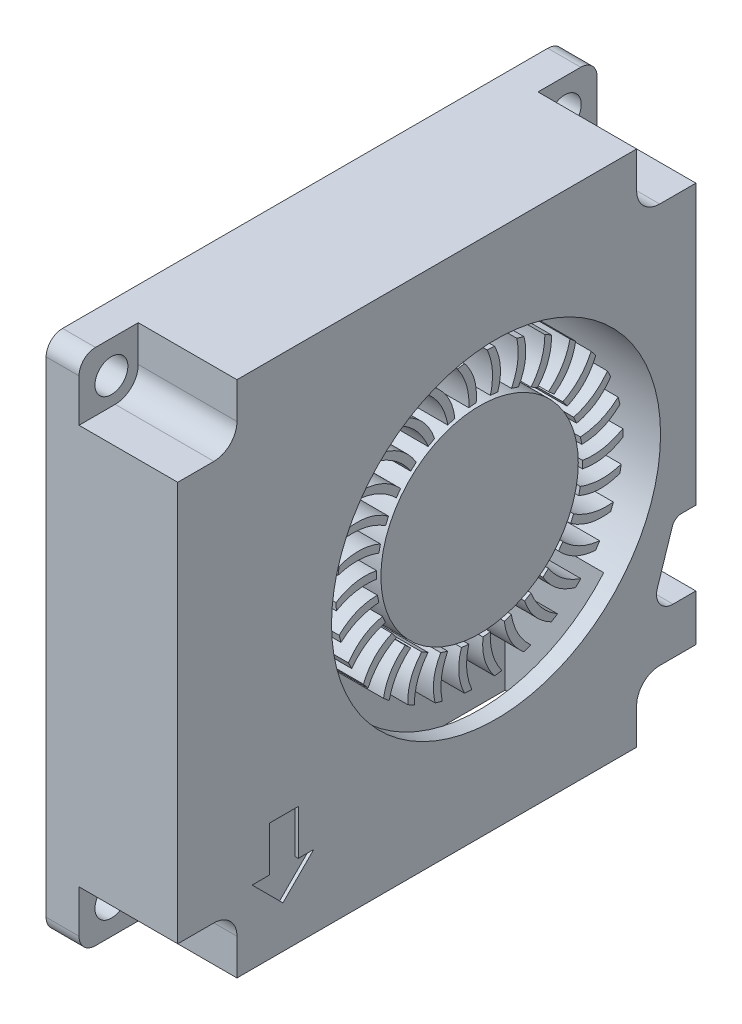
from build123d import *

# Parameters (mm, degrees)
BOSS_EXTRUDE1_DEPTH     = 10.16
CUT_EXTRUDE1_DEPTH      = 7.62
SKETCH3_R               = 12.7
CUT_EXTRUDE2_DEPTH      = 8.89
SKETCH4_W               = 7.62
SKETCH4_H               = 28.31600001
CUT_EXTRUDE3_DEPTH      = 36.576
SKETCH5_R               = 11.43
BOSS_EXTRUDE2_DEPTH     = 1.27
SKETCH6_R               = 7.62
BOSS_EXTRUDE3_DEPTH     = 6.35
CUT_EXTRUDE4_DEPTH      = 0.254
CUT_EXTRUDE5_DEPTH      = 7.62
CUT_EXTRUDE6_DEPTH      = 31.053711924
CUT_EXTRUDE6_DEPTH_BACK = 31.053711924
SKETCH9_R               = 1.27


with BuildPart() as part:
    # Sketch1 → Boss-Extrude1 (new body)
    with BuildSketch(Plane.YZ):
        with BuildLine():
            Line((-18.730000005, -20.000000005), (18.730000005, -20.000000005))
            ThreePointArc((18.730000005, -20.000000005), (19.628025617, -19.628025617), (20.000000005, -18.730000005))
            Line((20.000000005, -18.730000005), (20.000000005, 18.730000005))
            ThreePointArc((20.000000005, 18.730000005), (19.628025617, 19.628025617), (18.730000005, 20.000000005))
            Line((18.730000005, 20.000000005), (-18.730000005, 20.000000005))
            ThreePointArc((-18.730000005, 20.000000005), (-19.628025617, 19.628025617), (-20.000000005, 18.730000005))
            Line((-20.000000005, 18.730000005), (-20.000000005, -18.730000005))
            ThreePointArc((-20.000000005, -18.730000005), (-19.628025617, -19.628025617), (-18.730000005, -20.000000005))
        make_face()
    extrude(amount=BOSS_EXTRUDE1_DEPTH)

    # Sketch2 → Cut-Extrude1 (cut)
    with BuildSketch(Plane.YZ.offset(10.16)):
        with BuildLine():
            Line((-24.572000005, 24.572000005), (-15.428000005, 24.572000005))
            Line((-15.428000005, 24.572000005), (-15.428000005, 17.206000005))
            ThreePointArc((-15.428000005, 17.206000005), (-15.948764148, 15.948764148), (-17.206000005, 15.428000005))
            Line((-17.206000005, 15.428000005), (-24.572000005, 15.428000005))
            Line((-24.572000005, 15.428000005), (-24.572000005, 24.572000005))
        make_face()
        with BuildLine():
            Line((24.572000005, 24.572000005), (15.428000005, 24.572000005))
            Line((15.428000005, 24.572000005), (15.428000005, 17.206000005))
            ThreePointArc((15.428000005, 17.206000005), (15.948764148, 15.948764148), (17.206000005, 15.428000005))
            Line((17.206000005, 15.428000005), (24.572000005, 15.428000005))
            Line((24.572000005, 15.428000005), (24.572000005, 24.572000005))
        make_face()
        with BuildLine():
            Line((24.572000005, -24.572000005), (24.572000005, -15.428000005))
            Line((24.572000005, -15.428000005), (17.206000005, -15.428000005))
            ThreePointArc((17.206000005, -15.428000005), (15.948764148, -15.948764148), (15.428000005, -17.206000005))
            Line((15.428000005, -17.206000005), (15.428000005, -24.572000005))
            Line((15.428000005, -24.572000005), (24.572000005, -24.572000005))
        make_face()
        with BuildLine():
            Line((-24.572000005, -24.572000005), (-15.428000005, -24.572000005))
            Line((-15.428000005, -24.572000005), (-15.428000005, -17.206000005))
            ThreePointArc((-15.428000005, -17.206000005), (-15.948764148, -15.948764148), (-17.206000005, -15.428000005))
            Line((-17.206000005, -15.428000005), (-24.572000005, -15.428000005))
            Line((-24.572000005, -15.428000005), (-24.572000005, -24.572000005))
        make_face()
    extrude(amount=-CUT_EXTRUDE1_DEPTH, mode=Mode.SUBTRACT)

    # Sketch3 → Cut-Extrude2 (cut)
    with BuildSketch(Plane.YZ.offset(10.16)):
        with Locations((0, -4.572)):
            Circle(SKETCH3_R)
    extrude(amount=-CUT_EXTRUDE2_DEPTH, mode=Mode.SUBTRACT)

    # Sketch4 → Cut-Extrude3 (cut)
    with BuildSketch(Plane.XZ.offset(20.000000005)):
        with Locations((5.08, 0)):
            Rectangle(SKETCH4_W, SKETCH4_H)
    extrude(amount=-CUT_EXTRUDE3_DEPTH, mode=Mode.SUBTRACT)

    # Sketch5 → Boss-Extrude2 (add)
    with BuildSketch(Plane.YZ.offset(1.27)):
        with Locations((0, -4.572)):
            Circle(SKETCH5_R)
    extrude(amount=BOSS_EXTRUDE2_DEPTH)

    # Sketch6 → Boss-Extrude3 (add)
    with BuildSketch(Plane.YZ.offset(2.54)):
        with Locations((0, -4.572)):
            Circle(SKETCH6_R)
        with BuildLine():
            Line((-0.563275913, 6.4854637), (0, 6.506990602))
            add(Edge.make_bspline(
                [(0.573958991, 3.375042592), (0.919154895, 5.057851625), (0, 6.506990602)],
                knots=[0, 0, 0, 1, 1, 1], degree=2))
            Line((0.573958991, 3.375042592), (0, 3.375042592))
            add(Edge.make_bspline(
                [(0, 3.375042592), (0.261683692, 5.025053284), (-0.563275913, 6.4854637)],
                knots=[0, 0, 0, 1, 1, 1], degree=2))
        make_face()
        with BuildLine():
            Line((1.652283062, 3.201380644), (2.213699672, 3.08204786))
            add(Edge.make_bspline(
                [(2.213699672, 3.08204786), (2.901227889, 4.656313214), (2.303451669, 6.264888076)],
                knots=[0, 0, 0, 1, 1, 1], degree=2))
            Line((2.303451669, 6.264888076), (1.748008991, 6.360943236))
            add(Edge.make_bspline(
                [(1.652283062, 3.201380644), (2.25130485, 4.760927545), (1.748008991, 6.360943236)],
                knots=[0, 0, 0, 1, 1, 1], degree=2))
        make_face()
        with BuildLine():
            Line((3.232353426, 2.687984662), (3.756691055, 2.454534508))
            add(Edge.make_bspline(
                [(3.756691055, 2.454534508), (4.756503303, 3.851453233), (4.506231446, 5.54916154)],
                knots=[0, 0, 0, 1, 1, 1], degree=2))
            Line((4.506231446, 5.54916154), (3.982897514, 5.758600691))
            add(Edge.make_bspline(
                [(3.232353426, 2.687984662), (4.142533184, 4.088908088), (3.982897514, 5.758600691)],
                knots=[0, 0, 0, 1, 1, 1], degree=2))
        make_face()
        with BuildLine():
            Line((4.671154435, 1.857292512), (5.135497013, 1.519927882))
            add(Edge.make_bspline(
                [(5.135497013, 1.519927882), (6.403896698, 2.678447926), (6.512067286, 4.391091678)],
                knots=[0, 0, 0, 1, 1, 1], degree=2))
            Line((6.512067286, 4.391091678), (6.043714304, 4.704761323))
            add(Edge.make_bspline(
                [(4.671154435, 1.857292512), (5.85271294, 3.038365388), (6.043714304, 4.704761323)],
                knots=[0, 0, 0, 1, 1, 1], degree=2))
        make_face()
        with BuildLine():
            Line((5.90580358, 0.745609428), (6.289857108, 0.319074774))
            add(Edge.make_bspline(
                [(6.289857108, 0.319074774), (7.771409078, 1.188563253), (8.233294537, 2.841291699)],
                knots=[0, 0, 0, 1, 1, 1], degree=2))
            Line((8.233294537, 2.841291699), (7.840391778, 3.245482971))
            add(Edge.make_bspline(
                [(5.90580358, 0.745609428), (7.307101055, 1.655213202), (7.840391778, 3.245482971)],
                knots=[0, 0, 0, 1, 1, 1], degree=2))
        make_face()
        with BuildLine():
            Line((6.88234077, -0.598478704), (7.169320265, -1.095541771))
            add(Edge.make_bspline(
                [(7.169320265, -1.095541771), (8.79927359, -0.553085677), (9.59468731, 0.967495301)],
                knots=[0, 0, 0, 1, 1, 1], degree=2))
            Line((9.59468731, 0.967495301), (9.294406509, 1.444543101))
            add(Edge.make_bspline(
                [(6.88234077, -0.598478704), (8.442133792, -9.8083e-05), (9.294406509, 1.444543101)],
                knots=[0, 0, 0, 1, 1, 1], degree=2))
        make_face()
        with BuildLine():
            Line((7.558086642, -2.116228784), (7.735449725, -2.662096222))
            add(Edge.make_bspline(
                [(7.735449725, -2.662096222), (9.442567622, -2.470380447), (10.536746206, -1.148403623)],
                knots=[0, 0, 0, 1, 1, 1], degree=2))
            Line((10.536746206, -1.148403623), (10.342211076, -0.619348574))
            add(Edge.make_bspline(
                [(7.558086642, -2.116228784), (9.208204771, -1.85522342), (10.342211076, -0.619348574)],
                knots=[0, 0, 0, 1, 1, 1], degree=2))
        make_face()
        with BuildLine():
            Line((7.903507861, -3.74130785), (7.963502912, -4.312122634))
            add(Edge.make_bspline(
                [(7.963502912, -4.312122634), (9.673176139, -4.479526077), (11.018298732, -3.413930138)],
                knots=[0, 0, 0, 1, 1, 1], degree=2))
            Line((11.018298732, -3.413930138), (10.938011392, -2.855990083))
            add(Edge.make_bspline(
                [(7.903507861, -3.74130785), (9.571833016, -3.829084929), (10.938011392, -2.855990083)],
                knots=[0, 0, 0, 1, 1, 1], degree=2))
        make_face()
        with BuildLine():
            Line((7.903507861, -5.40269215), (7.84351281, -5.973506933))
            add(Edge.make_bspline(
                [(7.84351281, -5.973506933), (9.481020442, -6.49271326), (11.018298732, -5.730069862)],
                knots=[0, 0, 0, 1, 1, 1], degree=2))
            Line((11.018298732, -5.730069862), (11.055768123, -5.167629459))
            add(Edge.make_bspline(
                [(7.903507861, -5.40269215), (9.517126228, -5.835415393), (11.055768123, -5.167629459)],
                knots=[0, 0, 0, 1, 1, 1], degree=2))
        make_face()
        with BuildLine():
            Line((7.558086642, -7.027771216), (7.38072356, -7.573638654))
            add(Edge.make_bspline(
                [(7.38072356, -7.573638654), (8.874498656, -8.421956058), (10.536746206, -7.995596377)],
                knots=[0, 0, 0, 1, 1, 1], degree=2))
            Line((10.536746206, -7.995596377), (10.690334736, -7.45323697))
            add(Edge.make_bspline(
                [(7.558086642, -7.027771216), (9.046475355, -7.786528541), (10.690334736, -7.45323697)],
                knots=[0, 0, 0, 1, 1, 1], degree=2))
        make_face()
        with BuildLine():
            Line((6.88234077, -8.545521296), (6.595361274, -9.042584363))
            add(Edge.make_bspline(
                [(6.595361274, -9.042584363), (7.880118695, -10.182937302), (9.59468731, -10.111495301)],
                knots=[0, 0, 0, 1, 1, 1], degree=2))
            Line((9.59468731, -10.111495301), (9.857682423, -9.6129206))
            add(Edge.make_bspline(
                [(6.88234077, -8.545521296), (8.1804501, -9.597151367), (9.857682423, -9.6129206)],
                knots=[0, 0, 0, 1, 1, 1], degree=2))
        make_face()
        with BuildLine():
            Line((5.90580358, -9.889609428), (5.521750052, -10.316144082))
            add(Edge.make_bspline(
                [(5.521750052, -10.316144082), (6.541339733, -11.698693661), (8.233294537, -11.985291699)],
                knots=[0, 0, 0, 1, 1, 1], degree=2))
            Line((8.233294537, -11.985291699), (8.594202085, -11.55229181))
            add(Edge.make_bspline(
                [(5.90580358, -9.889609428), (6.956899921, -11.188150965), (8.594202085, -11.55229181)],
                knots=[0, 0, 0, 1, 1, 1], degree=2))
        make_face()
        with BuildLine():
            Line((4.671154435, -11.001292512), (4.206811857, -11.338657142))
            add(Edge.make_bspline(
                [(4.206811857, -11.338657142), (4.916672836, -12.90297931), (6.512067286, -13.535091678)],
                knots=[0, 0, 0, 1, 1, 1], degree=2))
            Line((6.512067286, -13.535091678), (6.955113877, -13.186590773))
            add(Edge.make_bspline(
                [(4.671154435, -11.001292512), (5.429299832, -12.489993018), (6.955113877, -13.186590773)],
                knots=[0, 0, 0, 1, 1, 1], degree=2))
        make_face()
        with BuildLine():
            Line((3.232353426, -11.831984662), (2.708015797, -12.065434815))
            add(Edge.make_bspline(
                [(2.708015797, -12.065434815), (3.077123744, -13.743161187), (4.506231446, -14.69316154)],
                knots=[0, 0, 0, 1, 1, 1], degree=2))
            Line((4.506231446, -14.69316154), (5.012053819, -14.444390782))
            add(Edge.make_bspline(
                [(3.232353426, -11.831984662), (3.664413288, -13.445780781), (5.012053819, -14.444390782)],
                knots=[0, 0, 0, 1, 1, 1], degree=2))
        make_face()
        with BuildLine():
            Line((1.652283062, -12.345380644), (1.090866452, -12.464713428))
            add(Edge.make_bspline(
                [(1.090866452, -12.464713428), (1.103089578, -14.182519311), (2.303451669, -15.408888076)],
                knots=[0, 0, 0, 1, 1, 1], degree=2))
            Line((2.303451669, -15.408888076), (2.849942957, -15.270719941))
            add(Edge.make_bspline(
                [(1.652283062, -12.345380644), (1.7393743, -14.013741743), (2.849942957, -15.270719941)],
                knots=[0, 0, 0, 1, 1, 1], degree=2))
        make_face()
        with BuildLine():
            Line((0, -12.519042592), (-0.573958991, -12.519042592))
            add(Edge.make_bspline(
                [(-0.573958991, -12.519042592), (-0.919154895, -14.201851625), (0, -15.650990602)],
                knots=[0, 0, 0, 1, 1, 1], degree=2))
            Line((0, -15.650990602), (0.563275913, -15.6294637))
            add(Edge.make_bspline(
                [(0, -12.519042592), (-0.261683692, -14.169053284), (0.563275913, -15.6294637)],
                knots=[0, 0, 0, 1, 1, 1], degree=2))
        make_face()
        with BuildLine():
            Line((-1.652283062, -12.345380644), (-2.213699672, -12.22604786))
            add(Edge.make_bspline(
                [(-2.213699672, -12.22604786), (-2.901227889, -13.800313214), (-2.303451669, -15.408888076)],
                knots=[0, 0, 0, 1, 1, 1], degree=2))
            Line((-2.303451669, -15.408888076), (-1.748008991, -15.504943236))
            add(Edge.make_bspline(
                [(-1.652283062, -12.345380644), (-2.25130485, -13.904927545), (-1.748008991, -15.504943236)],
                knots=[0, 0, 0, 1, 1, 1], degree=2))
        make_face()
        with BuildLine():
            Line((-3.232353426, -11.831984662), (-3.756691055, -11.598534508))
            add(Edge.make_bspline(
                [(-3.756691055, -11.598534508), (-4.756503303, -12.995453233), (-4.506231446, -14.69316154)],
                knots=[0, 0, 0, 1, 1, 1], degree=2))
            Line((-4.506231446, -14.69316154), (-3.982897514, -14.902600691))
            add(Edge.make_bspline(
                [(-3.232353426, -11.831984662), (-4.142533184, -13.232908088), (-3.982897514, -14.902600691)],
                knots=[0, 0, 0, 1, 1, 1], degree=2))
        make_face()
        with BuildLine():
            Line((-4.671154435, -11.001292512), (-5.135497013, -10.663927882))
            add(Edge.make_bspline(
                [(-5.135497013, -10.663927882), (-6.403896698, -11.822447926), (-6.512067286, -13.535091678)],
                knots=[0, 0, 0, 1, 1, 1], degree=2))
            Line((-6.512067286, -13.535091678), (-6.043714304, -13.848761323))
            add(Edge.make_bspline(
                [(-4.671154435, -11.001292512), (-5.85271294, -12.182365388), (-6.043714304, -13.848761323)],
                knots=[0, 0, 0, 1, 1, 1], degree=2))
        make_face()
        with BuildLine():
            Line((-5.90580358, -9.889609428), (-6.289857108, -9.463074774))
            add(Edge.make_bspline(
                [(-6.289857108, -9.463074774), (-7.771409078, -10.332563253), (-8.233294537, -11.985291699)],
                knots=[0, 0, 0, 1, 1, 1], degree=2))
            Line((-8.233294537, -11.985291699), (-7.840391778, -12.389482971))
            add(Edge.make_bspline(
                [(-5.90580358, -9.889609428), (-7.307101055, -10.799213202), (-7.840391778, -12.389482971)],
                knots=[0, 0, 0, 1, 1, 1], degree=2))
        make_face()
        with BuildLine():
            Line((-6.88234077, -8.545521296), (-7.169320265, -8.048458229))
            add(Edge.make_bspline(
                [(-7.169320265, -8.048458229), (-8.79927359, -8.590914323), (-9.59468731, -10.111495301)],
                knots=[0, 0, 0, 1, 1, 1], degree=2))
            Line((-9.59468731, -10.111495301), (-9.294406509, -10.588543101))
            add(Edge.make_bspline(
                [(-6.88234077, -8.545521296), (-8.442133792, -9.143901917), (-9.294406509, -10.588543101)],
                knots=[0, 0, 0, 1, 1, 1], degree=2))
        make_face()
        with BuildLine():
            Line((-7.558086642, -7.027771216), (-7.735449725, -6.481903778))
            add(Edge.make_bspline(
                [(-7.735449725, -6.481903778), (-9.442567622, -6.673619553), (-10.536746206, -7.995596377)],
                knots=[0, 0, 0, 1, 1, 1], degree=2))
            Line((-10.536746206, -7.995596377), (-10.342211076, -8.524651426))
            add(Edge.make_bspline(
                [(-7.558086642, -7.027771216), (-9.208204771, -7.28877658), (-10.342211076, -8.524651426)],
                knots=[0, 0, 0, 1, 1, 1], degree=2))
        make_face()
        with BuildLine():
            Line((-7.903507861, -5.40269215), (-7.963502912, -4.831877366))
            add(Edge.make_bspline(
                [(-7.963502912, -4.831877366), (-9.673176139, -4.664473923), (-11.018298732, -5.730069862)],
                knots=[0, 0, 0, 1, 1, 1], degree=2))
            Line((-11.018298732, -5.730069862), (-10.938011392, -6.288009917))
            add(Edge.make_bspline(
                [(-7.903507861, -5.40269215), (-9.571833016, -5.314915071), (-10.938011392, -6.288009917)],
                knots=[0, 0, 0, 1, 1, 1], degree=2))
        make_face()
        with BuildLine():
            Line((-7.903507861, -3.74130785), (-7.84351281, -3.170493067))
            add(Edge.make_bspline(
                [(-7.84351281, -3.170493067), (-9.481020442, -2.65128674), (-11.018298732, -3.413930138)],
                knots=[0, 0, 0, 1, 1, 1], degree=2))
            Line((-11.018298732, -3.413930138), (-11.055768123, -3.976370541))
            add(Edge.make_bspline(
                [(-7.903507861, -3.74130785), (-9.517126228, -3.308584607), (-11.055768123, -3.976370541)],
                knots=[0, 0, 0, 1, 1, 1], degree=2))
        make_face()
        with BuildLine():
            Line((-7.558086642, -2.116228784), (-7.38072356, -1.570361346))
            add(Edge.make_bspline(
                [(-7.38072356, -1.570361346), (-8.874498656, -0.722043942), (-10.536746206, -1.148403623)],
                knots=[0, 0, 0, 1, 1, 1], degree=2))
            Line((-10.536746206, -1.148403623), (-10.690334736, -1.69076303))
            add(Edge.make_bspline(
                [(-7.558086642, -2.116228784), (-9.046475355, -1.357471459), (-10.690334736, -1.69076303)],
                knots=[0, 0, 0, 1, 1, 1], degree=2))
        make_face()
        with BuildLine():
            Line((-6.88234077, -0.598478704), (-6.595361274, -0.101415637))
            add(Edge.make_bspline(
                [(-6.595361274, -0.101415637), (-7.880118695, 1.038937302), (-9.59468731, 0.967495301)],
                knots=[0, 0, 0, 1, 1, 1], degree=2))
            Line((-9.59468731, 0.967495301), (-9.857682423, 0.4689206))
            add(Edge.make_bspline(
                [(-6.88234077, -0.598478704), (-8.1804501, 0.453151367), (-9.857682423, 0.4689206)],
                knots=[0, 0, 0, 1, 1, 1], degree=2))
        make_face()
        with BuildLine():
            Line((-5.90580358, 0.745609428), (-5.521750052, 1.172144082))
            add(Edge.make_bspline(
                [(-5.521750052, 1.172144082), (-6.541339733, 2.554693661), (-8.233294537, 2.841291699)],
                knots=[0, 0, 0, 1, 1, 1], degree=2))
            Line((-8.233294537, 2.841291699), (-8.594202085, 2.40829181))
            add(Edge.make_bspline(
                [(-5.90580358, 0.745609428), (-6.956899921, 2.044150965), (-8.594202085, 2.40829181)],
                knots=[0, 0, 0, 1, 1, 1], degree=2))
        make_face()
        with BuildLine():
            Line((-4.671154435, 1.857292512), (-4.206811857, 2.194657142))
            add(Edge.make_bspline(
                [(-4.206811857, 2.194657142), (-4.916672836, 3.75897931), (-6.512067286, 4.391091678)],
                knots=[0, 0, 0, 1, 1, 1], degree=2))
            Line((-6.512067286, 4.391091678), (-6.955113877, 4.042590773))
            add(Edge.make_bspline(
                [(-4.671154435, 1.857292512), (-5.429299832, 3.345993018), (-6.955113877, 4.042590773)],
                knots=[0, 0, 0, 1, 1, 1], degree=2))
        make_face()
        with BuildLine():
            Line((-3.232353426, 2.687984662), (-2.708015797, 2.921434815))
            add(Edge.make_bspline(
                [(-2.708015797, 2.921434815), (-3.077123744, 4.599161187), (-4.506231446, 5.54916154)],
                knots=[0, 0, 0, 1, 1, 1], degree=2))
            Line((-4.506231446, 5.54916154), (-5.012053819, 5.300390782))
            add(Edge.make_bspline(
                [(-3.232353426, 2.687984662), (-3.664413288, 4.301780781), (-5.012053819, 5.300390782)],
                knots=[0, 0, 0, 1, 1, 1], degree=2))
        make_face()
        with BuildLine():
            Line((-1.652283062, 3.201380644), (-1.090866452, 3.320713428))
            add(Edge.make_bspline(
                [(-1.090866452, 3.320713428), (-1.103089578, 5.038519311), (-2.303451669, 6.264888076)],
                knots=[0, 0, 0, 1, 1, 1], degree=2))
            Line((-2.303451669, 6.264888076), (-2.849942957, 6.126719941))
            add(Edge.make_bspline(
                [(-1.652283062, 3.201380644), (-1.7393743, 4.869741743), (-2.849942957, 6.126719941)],
                knots=[0, 0, 0, 1, 1, 1], degree=2))
        make_face()
    extrude(amount=BOSS_EXTRUDE3_DEPTH)

    # Sketch7 → Cut-Extrude4 (cut)
    with BuildSketch(Plane.YZ.offset(10.16)):
        Polygon((-10.89901967, 12.923616865), (-14.371746525, 12.923616865), (-14.371746525, 14.259281041), (-16.749228757, 11.881798809), (-14.371746525, 9.504316577), (-14.371746525, 10.693057693), (-10.89901967, 10.693057693), align=None)
    extrude(amount=-CUT_EXTRUDE4_DEPTH, mode=Mode.SUBTRACT)

    # Sketch8 → Cut-Extrude5 (cut)
    with BuildSketch(Plane.YZ.offset(10.16)):
        with BuildLine():
            Line((-11.83565345, -20.000000005), (-11.83565345, -18.232789178))
            ThreePointArc((-11.83565345, -18.232789178), (-11.311874857, -17.205144486), (-10.172576895, -17.025150647))
            Line((-10.172576895, -17.025150647), (-6.631423267, -18.177767456))
            ThreePointArc((-6.631423267, -18.177767456), (-6.250682385, -18.454617731), (-6.105269201, -18.902350575))
            Line((-6.105269201, -18.902350575), (-6.105269201, -20.000000005))
            Line((-6.105269201, -20.000000005), (-11.83565345, -20.000000005))
        make_face()
    extrude(amount=-CUT_EXTRUDE5_DEPTH, mode=Mode.SUBTRACT)

    # Sketch9 → Cut-Extrude6 (cut, two sides: drawn at the far end of the back side and taken through both)
    with BuildSketch(Plane(origin=(0, 0, 0), x_dir=(0, -1, 0), z_dir=(-1, 0, 0)).offset(-CUT_EXTRUDE6_DEPTH_BACK)):
        with Locations((-17.5, 17.5)):
            Circle(SKETCH9_R)
        with Locations((17.5, 17.5)):
            Circle(SKETCH9_R)
        with Locations((17.5, -17.5)):
            Circle(SKETCH9_R)
        with Locations((-17.5, -17.5)):
            Circle(SKETCH9_R)
    extrude(amount=CUT_EXTRUDE6_DEPTH + CUT_EXTRUDE6_DEPTH_BACK, mode=Mode.SUBTRACT)


solid = part.part
